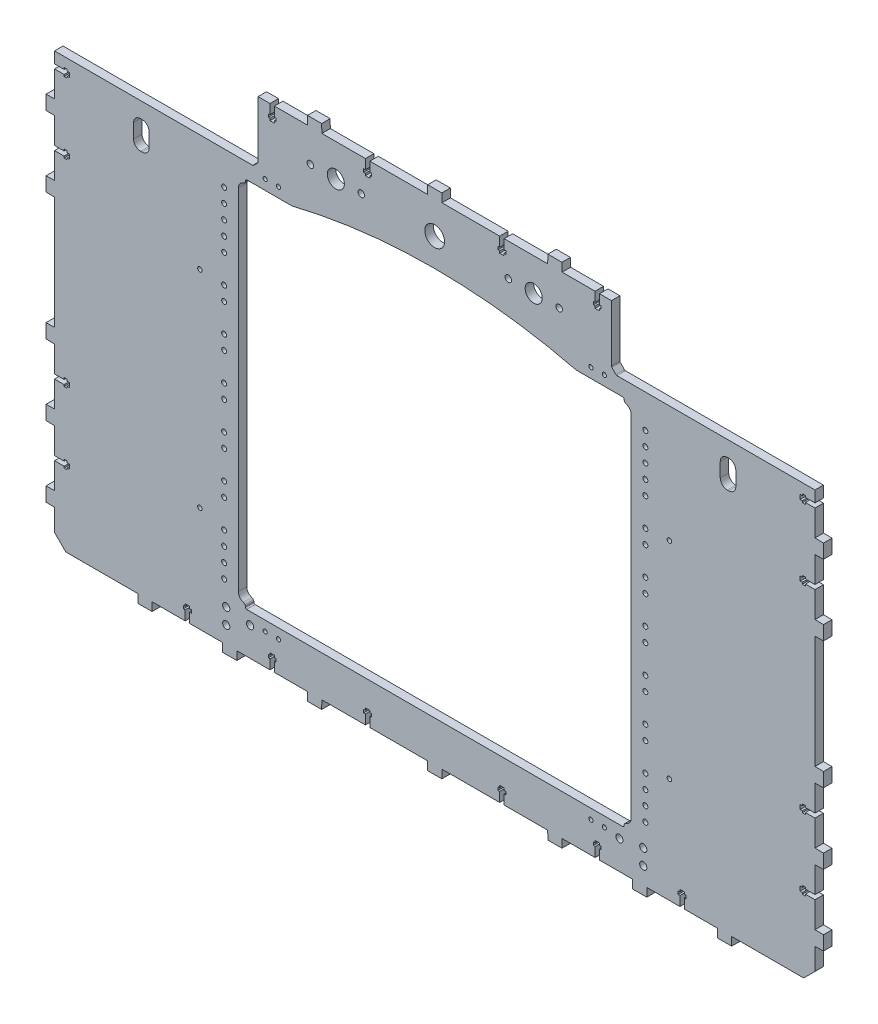
from build123d import *

# Parameters (mm, degrees)
SKETCH_1_R      = 1.6
SKETCH_1_R_2    = 1.75
SKETCH_1_R_3    = 2.55
SKETCH_1_R_4    = 1.5
SKETCH_1_R_5    = 2.3
SKETCH_1_R_6    = 6.05
SKETCH_1_R_7    = 7
EXTRUDE_1_DEPTH = 6


with BuildPart() as part:
    # Эскиз1 → Бобышка-Вытянуть1 (new body)
    with BuildSketch(Plane.XY):
        with BuildLine():
            Line((1433.58045076, 343.057239019), (1435.08045076, 343.057239019))
            Line((1435.08045076, 343.057239019), (1435.08045076, 339.95723902))
            Line((1435.08045076, 339.95723902), (1433.58045076, 339.95723902))
            Line((1433.58045076, 339.95723902), (1433.58045076, 338.75723902))
            Line((1433.58045076, 338.75723902), (1431.38045076, 338.75723902))
            Line((1431.38045076, 338.75723902), (1431.38045076, 339.95723902))
            Line((1431.38045076, 339.95723902), (1424.58045076, 339.95723902))
            Line((1424.58045076, 339.95723902), (1424.58045076, 321.60723902))
            Line((1424.58045076, 321.60723902), (1418.580450762, 321.50723902))
            Line((1418.580450762, 321.50723902), (1418.580450762, 311.50723902))
            Line((1418.580450762, 311.50723902), (1424.58045076, 311.407239019))
            Line((1424.58045076, 311.407239019), (1424.58045076, 293.05723902))
            Line((1424.58045076, 293.05723902), (1431.38045076, 293.05723902))
            Line((1431.38045076, 293.05723902), (1431.38045076, 294.25723902))
            Line((1431.38045076, 294.25723902), (1433.58045076, 294.25723902))
            Line((1433.58045076, 294.25723902), (1433.58045076, 293.05723902))
            Line((1433.58045076, 293.05723902), (1435.08045076, 293.05723902))
            Line((1435.08045076, 293.05723902), (1435.08045076, 289.95723902))
            Line((1435.08045076, 289.95723902), (1433.58045076, 289.95723902))
            Line((1433.58045076, 289.95723902), (1433.58045076, 288.75723902))
            Line((1433.58045076, 288.75723902), (1431.38045076, 288.75723902))
            Line((1431.38045076, 288.75723902), (1431.38045076, 289.95723902))
            Line((1431.38045076, 289.95723902), (1424.58045076, 289.95723902))
            Line((1424.58045076, 289.95723902), (1424.58045076, 271.60723902))
            Line((1424.58045076, 271.60723902), (1418.580450762, 271.50723902))
            Line((1418.580450762, 271.50723902), (1418.580450762, 261.50723902))
            Line((1418.580450762, 261.50723902), (1424.58045076, 261.407239019))
            Line((1424.58045076, 261.407239019), (1424.58045076, 181.60723902))
            Line((1424.58045076, 181.60723902), (1418.580450762, 181.50723902))
            Line((1418.580450762, 181.50723902), (1418.580450762, 171.50723902))
            Line((1418.580450762, 171.50723902), (1424.58045076, 171.407239019))
            Line((1424.58045076, 171.407239019), (1424.58045076, 153.05723902))
            Line((1424.58045076, 153.05723902), (1431.38045076, 153.05723902))
            Line((1431.38045076, 153.05723902), (1431.38045076, 154.257239019))
            Line((1431.38045076, 154.257239019), (1433.58045076, 154.257239019))
            Line((1433.58045076, 154.257239019), (1433.58045076, 153.057239019))
            Line((1433.58045076, 153.057239019), (1435.08045076, 153.057239019))
            Line((1435.08045076, 153.057239019), (1435.08045076, 149.957239019))
            Line((1435.08045076, 149.957239019), (1433.58045076, 149.957239019))
            Line((1433.58045076, 149.957239019), (1433.58045076, 148.757239019))
            Line((1433.58045076, 148.757239019), (1431.38045076, 148.757239019))
            Line((1431.38045076, 148.757239019), (1431.38045076, 149.957239019))
            Line((1431.38045076, 149.957239019), (1424.58045076, 149.957239019))
            Line((1424.58045076, 149.957239019), (1424.58045076, 131.607239019))
            Line((1424.58045076, 131.607239019), (1418.580450762, 131.507239019))
            Line((1418.580450762, 131.507239019), (1418.580450762, 121.507239019))
            Line((1418.580450762, 121.507239019), (1424.58045076, 121.407239018))
            Line((1424.58045076, 121.407239018), (1424.58045076, 103.057239019))
            Line((1424.58045076, 103.057239019), (1431.38045076, 103.057239019))
            Line((1431.38045076, 103.057239019), (1431.38045076, 104.257239019))
            Line((1431.38045076, 104.257239019), (1433.58045076, 104.257239019))
            Line((1433.58045076, 104.257239019), (1433.58045076, 103.057239019))
            Line((1433.58045076, 103.057239019), (1435.08045076, 103.057239019))
            Line((1435.08045076, 103.057239019), (1435.08045076, 99.957239019))
            Line((1435.08045076, 99.957239019), (1433.58045076, 99.957239019))
            Line((1433.58045076, 99.957239019), (1433.58045076, 98.757239019))
            Line((1433.58045076, 98.757239019), (1431.38045076, 98.757239019))
            Line((1431.38045076, 98.757239019), (1431.38045076, 99.957239019))
            Line((1431.38045076, 99.957239019), (1424.58045076, 99.957239019))
            Line((1424.58045076, 99.957239019), (1424.58045076, 81.607239019))
            Line((1424.58045076, 81.607239019), (1418.580450762, 81.507239019))
            Line((1418.580450762, 81.507239019), (1418.580450762, 71.507239019))
            Line((1418.580450762, 71.507239019), (1424.58045076, 71.407239018))
            Line((1424.58045076, 71.407239018), (1424.58045076, 56.007239019))
            Line((1424.58045076, 56.007239019), (1432.58045076, 48.007239019))
            Line((1432.58045076, 48.007239019), (1483.480450759, 48.007239019))
            Line((1483.480450759, 48.007239019), (1483.58045076, 42.00723902))
            Line((1483.58045076, 42.00723902), (1493.58045076, 42.00723902))
            Line((1493.58045076, 42.00723902), (1493.68045076, 48.007239019))
            Line((1493.68045076, 48.007239019), (1517.03045076, 48.007239019))
            Line((1517.03045076, 48.007239019), (1517.03045076, 54.807239019))
            Line((1517.03045076, 54.807239019), (1515.830450761, 54.807239019))
            Line((1515.830450761, 54.807239019), (1515.830450761, 57.007239019))
            Line((1515.830450761, 57.007239019), (1517.030450761, 57.007239019))
            Line((1517.030450761, 57.007239019), (1517.030450761, 58.507239019))
            Line((1517.030450761, 58.507239019), (1520.130450761, 58.507239019))
            Line((1520.130450761, 58.507239019), (1520.130450761, 57.007239019))
            Line((1520.130450761, 57.007239019), (1521.330450761, 57.007239019))
            Line((1521.330450761, 57.007239019), (1521.330450761, 54.807239019))
            Line((1521.330450761, 54.807239019), (1520.130450761, 54.807239019))
            Line((1520.130450761, 54.807239019), (1520.130450761, 48.007239019))
            Line((1520.130450761, 48.007239019), (1532.58045076, 48.007239019))
            Line((1532.58045076, 48.007239019), (1543.48045076, 48.007239019))
            Line((1543.48045076, 48.007239019), (1543.580450761, 42.00723902))
            Line((1543.580450761, 42.00723902), (1553.580450761, 42.00723902))
            Line((1553.580450761, 42.00723902), (1553.680450761, 48.007239018))
            Line((1553.680450761, 48.007239018), (1577.030450761, 48.007239018))
            Line((1577.030450761, 48.007239018), (1577.030450761, 54.807239018))
            Line((1577.030450761, 54.807239018), (1575.830450761, 54.807239018))
            Line((1575.830450761, 54.807239018), (1575.830450761, 57.007239018))
            Line((1575.830450761, 57.007239018), (1577.030450761, 57.007239018))
            Line((1577.030450761, 57.007239018), (1577.030450761, 58.507239018))
            Line((1577.030450761, 58.507239018), (1580.130450761, 58.507239018))
            Line((1580.130450761, 58.507239018), (1580.130450761, 57.007239018))
            Line((1580.130450761, 57.007239018), (1581.330450761, 57.007239018))
            Line((1581.330450761, 57.007239018), (1581.330450761, 54.807239018))
            Line((1581.330450761, 54.807239018), (1580.130450761, 54.807239018))
            Line((1580.130450761, 54.807239018), (1580.130450761, 48.007239018))
            Line((1580.130450761, 48.007239018), (1603.48045076, 48.007239018))
            Line((1603.48045076, 48.007239018), (1603.580450761, 42.007239019))
            Line((1603.580450761, 42.007239019), (1613.580450761, 42.007239019))
            Line((1613.580450761, 42.007239019), (1613.680450761, 48.007239017))
            Line((1613.680450761, 48.007239017), (1644.530450761, 48.007239017))
            Line((1644.530450761, 48.007239017), (1644.530450761, 54.807239017))
            Line((1644.530450761, 54.807239017), (1643.330450762, 54.807239017))
            Line((1643.330450762, 54.807239017), (1643.330450762, 57.007239017))
            Line((1643.330450762, 57.007239017), (1644.530450762, 57.007239017))
            Line((1644.530450762, 57.007239017), (1644.530450762, 58.507239017))
            Line((1644.530450762, 58.507239017), (1647.630450762, 58.507239017))
            Line((1647.630450762, 58.507239017), (1647.630450762, 57.007239017))
            Line((1647.630450762, 57.007239017), (1648.830450762, 57.007239017))
            Line((1648.830450762, 57.007239017), (1648.830450762, 54.807239017))
            Line((1648.830450762, 54.807239017), (1647.630450762, 54.807239017))
            Line((1647.630450762, 54.807239017), (1647.630450762, 48.007239017))
            Line((1647.630450762, 48.007239017), (1688.480450762, 48.007239017))
            Line((1688.480450762, 48.007239017), (1688.580450762, 42.007239019))
            Line((1688.580450762, 42.007239019), (1698.580450762, 42.007239019))
            Line((1698.580450762, 42.007239019), (1698.680450762, 48.007239017))
            Line((1698.680450762, 48.007239017), (1739.530450762, 48.007239017))
            Line((1739.530450762, 48.007239017), (1739.530450762, 54.807239017))
            Line((1739.530450762, 54.807239017), (1738.330450762, 54.807239017))
            Line((1738.330450762, 54.807239017), (1738.330450762, 57.007239017))
            Line((1738.330450762, 57.007239017), (1739.530450762, 57.007239017))
            Line((1739.530450762, 57.007239017), (1739.530450762, 58.507239017))
            Line((1739.530450762, 58.507239017), (1742.630450762, 58.507239017))
            Line((1742.630450762, 58.507239017), (1742.630450762, 57.007239017))
            Line((1742.630450762, 57.007239017), (1743.830450762, 57.007239017))
            Line((1743.830450762, 57.007239017), (1743.830450762, 54.807239017))
            Line((1743.830450762, 54.807239017), (1742.630450762, 54.807239017))
            Line((1742.630450762, 54.807239017), (1742.630450762, 48.007239017))
            Line((1742.630450762, 48.007239017), (1773.480450762, 48.007239017))
            Line((1773.480450762, 48.007239017), (1773.580450762, 42.007239018))
            Line((1773.580450762, 42.007239018), (1783.580450762, 42.007239018))
            Line((1783.580450762, 42.007239018), (1783.680450762, 48.007239017))
            Line((1783.680450762, 48.007239017), (1807.030450762, 48.007239017))
            Line((1807.030450762, 48.007239017), (1807.030450762, 54.807239017))
            Line((1807.030450762, 54.807239017), (1805.830450762, 54.807239017))
            Line((1805.830450762, 54.807239017), (1805.830450762, 57.007239017))
            Line((1805.830450762, 57.007239017), (1807.030450762, 57.007239017))
            Line((1807.030450762, 57.007239017), (1807.030450762, 58.507239017))
            Line((1807.030450762, 58.507239017), (1810.130450762, 58.507239017))
            Line((1810.130450762, 58.507239017), (1810.130450762, 57.007239017))
            Line((1810.130450762, 57.007239017), (1811.330450762, 57.007239017))
            Line((1811.330450762, 57.007239017), (1811.330450762, 54.807239017))
            Line((1811.330450762, 54.807239017), (1810.130450762, 54.807239017))
            Line((1810.130450762, 54.807239017), (1810.130450762, 48.007239017))
            Line((1810.130450762, 48.007239017), (1833.480450762, 48.007239017))
            Line((1833.480450762, 48.007239017), (1833.580450762, 42.007239018))
            Line((1833.580450762, 42.007239018), (1843.580450762, 42.007239018))
            Line((1843.580450762, 42.007239018), (1843.680450762, 48.007239017))
            Line((1843.680450762, 48.007239017), (1854.580450762, 48.007239017))
            Line((1854.580450762, 48.007239017), (1867.030450762, 48.007239017))
            Line((1867.030450762, 48.007239017), (1867.030450762, 54.807239017))
            Line((1867.030450762, 54.807239017), (1865.830450762, 54.807239017))
            Line((1865.830450762, 54.807239017), (1865.830450762, 57.007239017))
            Line((1865.830450762, 57.007239017), (1867.030450762, 57.007239017))
            Line((1867.030450762, 57.007239017), (1867.030450762, 58.507239017))
            Line((1867.030450762, 58.507239017), (1870.130450762, 58.507239017))
            Line((1870.130450762, 58.507239017), (1870.130450762, 57.007239017))
            Line((1870.130450762, 57.007239017), (1871.330450762, 57.007239017))
            Line((1871.330450762, 57.007239017), (1871.330450762, 54.807239017))
            Line((1871.330450762, 54.807239017), (1870.130450762, 54.807239017))
            Line((1870.130450762, 54.807239017), (1870.130450762, 48.007239017))
            Line((1870.130450762, 48.007239017), (1893.480450762, 48.007239017))
            Line((1893.480450762, 48.007239017), (1893.580450762, 42.007239018))
            Line((1893.580450762, 42.007239018), (1903.580450762, 42.007239018))
            Line((1903.580450762, 42.007239018), (1903.680450762, 48.007239017))
            Line((1903.680450762, 48.007239017), (1954.580450762, 48.007239017))
            Line((1954.580450762, 48.007239017), (1962.58045076, 56.007239017))
            Line((1962.58045076, 56.007239017), (1962.58045076, 71.407239016))
            Line((1962.58045076, 71.407239016), (1968.580450759, 71.507239016))
            Line((1968.580450759, 71.507239016), (1968.580450759, 81.507239016))
            Line((1968.580450759, 81.507239016), (1962.58045076, 81.607239016))
            Line((1962.58045076, 81.607239016), (1962.58045076, 99.957239016))
            Line((1962.58045076, 99.957239016), (1955.78045076, 99.957239016))
            Line((1955.78045076, 99.957239016), (1955.78045076, 98.757239016))
            Line((1955.78045076, 98.757239016), (1953.58045076, 98.757239016))
            Line((1953.58045076, 98.757239016), (1953.58045076, 99.957239016))
            Line((1953.58045076, 99.957239016), (1952.08045076, 99.957239016))
            Line((1952.08045076, 99.957239016), (1952.08045076, 103.057239016))
            Line((1952.08045076, 103.057239016), (1953.58045076, 103.057239016))
            Line((1953.58045076, 103.057239016), (1953.58045076, 104.257239016))
            Line((1953.58045076, 104.257239016), (1955.78045076, 104.257239016))
            Line((1955.78045076, 104.257239016), (1955.78045076, 103.057239016))
            Line((1955.78045076, 103.057239016), (1962.58045076, 103.057239016))
            Line((1962.58045076, 103.057239016), (1962.58045076, 121.407239016))
            Line((1962.58045076, 121.407239016), (1968.580450759, 121.507239016))
            Line((1968.580450759, 121.507239016), (1968.580450759, 131.507239016))
            Line((1968.580450759, 131.507239016), (1962.58045076, 131.607239016))
            Line((1962.58045076, 131.607239016), (1962.58045076, 149.957239016))
            Line((1962.58045076, 149.957239016), (1955.78045076, 149.957239016))
            Line((1955.78045076, 149.957239016), (1955.78045076, 148.757239016))
            Line((1955.78045076, 148.757239016), (1953.58045076, 148.757239016))
            Line((1953.58045076, 148.757239016), (1953.58045076, 149.957239016))
            Line((1953.58045076, 149.957239016), (1952.08045076, 149.957239016))
            Line((1952.08045076, 149.957239016), (1952.08045076, 153.057239016))
            Line((1952.08045076, 153.057239016), (1953.58045076, 153.057239016))
            Line((1953.58045076, 153.057239016), (1953.58045076, 154.257239016))
            Line((1953.58045076, 154.257239016), (1955.78045076, 154.257239016))
            Line((1955.78045076, 154.257239016), (1955.78045076, 153.057239016))
            Line((1955.78045076, 153.057239016), (1962.58045076, 153.057239016))
            Line((1962.58045076, 153.057239016), (1962.58045076, 171.407239016))
            Line((1962.58045076, 171.407239016), (1968.580450759, 171.507239016))
            Line((1968.580450759, 171.507239016), (1968.580450759, 181.507239016))
            Line((1968.580450759, 181.507239016), (1962.58045076, 181.607239016))
            Line((1962.58045076, 181.607239016), (1962.58045076, 261.407239016))
            Line((1962.58045076, 261.407239016), (1968.580450759, 261.507239017))
            Line((1968.580450759, 261.507239017), (1968.580450759, 271.507239017))
            Line((1968.580450759, 271.507239017), (1962.58045076, 271.607239017))
            Line((1962.58045076, 271.607239017), (1962.58045076, 289.957239017))
            Line((1962.58045076, 289.957239017), (1955.78045076, 289.957239017))
            Line((1955.78045076, 289.957239017), (1955.78045076, 288.757239017))
            Line((1955.78045076, 288.757239017), (1953.58045076, 288.757239017))
            Line((1953.58045076, 288.757239017), (1953.58045076, 289.957239017))
            Line((1953.58045076, 289.957239017), (1952.08045076, 289.957239017))
            Line((1952.08045076, 289.957239017), (1952.08045076, 293.057239017))
            Line((1952.08045076, 293.057239017), (1953.58045076, 293.057239017))
            Line((1953.58045076, 293.057239017), (1953.58045076, 294.257239017))
            Line((1953.58045076, 294.257239017), (1955.78045076, 294.257239017))
            Line((1955.78045076, 294.257239017), (1955.78045076, 293.057239017))
            Line((1955.78045076, 293.057239017), (1962.58045076, 293.057239017))
            Line((1962.58045076, 293.057239017), (1962.58045076, 311.407239016))
            Line((1962.58045076, 311.407239016), (1968.580450759, 311.507239017))
            Line((1968.580450759, 311.507239017), (1968.580450759, 321.507239017))
            Line((1968.580450759, 321.507239017), (1962.58045076, 321.607239017))
            Line((1962.58045076, 321.607239017), (1962.58045076, 339.957239017))
            Line((1962.58045076, 339.957239017), (1955.78045076, 339.957239017))
            Line((1955.78045076, 339.957239017), (1955.78045076, 338.757239018))
            Line((1955.78045076, 338.757239018), (1953.58045076, 338.757239018))
            Line((1953.58045076, 338.757239018), (1953.58045076, 339.957239018))
            Line((1953.58045076, 339.957239018), (1952.08045076, 339.957239018))
            Line((1952.08045076, 339.957239018), (1952.08045076, 343.057239018))
            Line((1952.08045076, 343.057239018), (1953.58045076, 343.057239018))
            Line((1953.58045076, 343.057239018), (1953.58045076, 344.257239018))
            Line((1953.58045076, 344.257239018), (1955.78045076, 344.257239018))
            Line((1955.78045076, 344.257239018), (1955.78045076, 343.057239018))
            Line((1955.78045076, 343.057239018), (1962.58045076, 343.057239018))
            Line((1962.58045076, 343.057239018), (1962.58045076, 351.007239019))
            Line((1962.58045076, 351.007239019), (1862.580450761, 351.007239019))
            Line((1862.580450761, 351.007239019), (1822.494664324, 351.007239019))
            ThreePointArc((1822.494664324, 351.007239019), (1822.111980891, 351.083359486), (1821.787557542, 351.300132238))
            Line((1821.787557542, 351.300132238), (1818.87334398, 354.2143458))
            ThreePointArc((1818.87334398, 354.2143458), (1818.656571229, 354.538769149), (1818.580450761, 354.921452581))
            Line((1818.580450761, 354.921452581), (1818.580450761, 395.007239019))
            Line((1818.580450761, 395.007239019), (1810.130450761, 395.007239019))
            Line((1810.130450761, 395.007239019), (1810.130450761, 388.207239019))
            Line((1810.130450761, 388.207239019), (1811.330450761, 388.207239019))
            Line((1811.330450761, 388.207239019), (1811.330450761, 386.007239019))
            Line((1811.330450761, 386.007239019), (1810.130450761, 386.007239019))
            Line((1810.130450761, 386.007239019), (1810.130450761, 384.507239019))
            Line((1810.130450761, 384.507239019), (1807.030450761, 384.507239019))
            Line((1807.030450761, 384.507239019), (1807.030450761, 386.007239019))
            Line((1807.030450761, 386.007239019), (1805.830450761, 386.007239019))
            Line((1805.830450761, 386.007239019), (1805.830450761, 388.207239019))
            Line((1805.830450761, 388.207239019), (1807.030450761, 388.207239019))
            Line((1807.030450761, 388.207239019), (1807.030450761, 395.007239019))
            Line((1807.030450761, 395.007239019), (1783.680450762, 395.007239019))
            Line((1783.680450762, 395.007239019), (1783.580450761, 401.007239017))
            Line((1783.580450761, 401.007239017), (1773.580450761, 401.007239017))
            Line((1773.580450761, 401.007239017), (1773.480450761, 395.007239019))
            Line((1773.480450761, 395.007239019), (1742.630450761, 395.007239019))
            Line((1742.630450761, 395.007239019), (1742.630450761, 388.207239019))
            Line((1742.630450761, 388.207239019), (1743.83045076, 388.207239019))
            Line((1743.83045076, 388.207239019), (1743.83045076, 386.007239019))
            Line((1743.83045076, 386.007239019), (1742.63045076, 386.007239019))
            Line((1742.63045076, 386.007239019), (1742.63045076, 384.507239019))
            Line((1742.63045076, 384.507239019), (1739.53045076, 384.507239019))
            Line((1739.53045076, 384.507239019), (1739.53045076, 386.007239019))
            Line((1739.53045076, 386.007239019), (1738.33045076, 386.007239019))
            Line((1738.33045076, 386.007239019), (1738.33045076, 388.207239019))
            Line((1738.33045076, 388.207239019), (1739.53045076, 388.207239019))
            Line((1739.53045076, 388.207239019), (1739.53045076, 395.007239019))
            Line((1739.53045076, 395.007239019), (1698.680450761, 395.007239019))
            Line((1698.680450761, 395.007239019), (1698.58045076, 401.007239017))
            Line((1698.58045076, 401.007239017), (1688.58045076, 401.007239017))
            Line((1688.58045076, 401.007239017), (1688.48045076, 395.007239019))
            Line((1688.48045076, 395.007239019), (1647.63045076, 395.007239019))
            Line((1647.63045076, 395.007239019), (1647.63045076, 388.207239019))
            Line((1647.63045076, 388.207239019), (1648.83045076, 388.207239019))
            Line((1648.83045076, 388.207239019), (1648.83045076, 386.007239019))
            Line((1648.83045076, 386.007239019), (1647.63045076, 386.007239019))
            Line((1647.63045076, 386.007239019), (1647.63045076, 384.507239019))
            Line((1647.63045076, 384.507239019), (1644.53045076, 384.507239019))
            Line((1644.53045076, 384.507239019), (1644.53045076, 386.007239019))
            Line((1644.53045076, 386.007239019), (1643.33045076, 386.007239019))
            Line((1643.33045076, 386.007239019), (1643.33045076, 388.207239019))
            Line((1643.33045076, 388.207239019), (1644.53045076, 388.207239019))
            Line((1644.53045076, 388.207239019), (1644.53045076, 395.007239019))
            Line((1644.53045076, 395.007239019), (1613.680450761, 395.007239019))
            Line((1613.680450761, 395.007239019), (1613.58045076, 401.007239017))
            Line((1613.58045076, 401.007239017), (1603.58045076, 401.007239017))
            Line((1603.58045076, 401.007239017), (1603.48045076, 395.007239019))
            Line((1603.48045076, 395.007239019), (1580.13045076, 395.007239019))
            Line((1580.13045076, 395.007239019), (1580.13045076, 388.207239019))
            Line((1580.13045076, 388.207239019), (1581.33045076, 388.207239019))
            Line((1581.33045076, 388.207239019), (1581.33045076, 386.007239019))
            Line((1581.33045076, 386.007239019), (1580.13045076, 386.007239019))
            Line((1580.13045076, 386.007239019), (1580.13045076, 384.507239019))
            Line((1580.13045076, 384.507239019), (1577.03045076, 384.507239019))
            Line((1577.03045076, 384.507239019), (1577.03045076, 386.007239019))
            Line((1577.03045076, 386.007239019), (1575.83045076, 386.007239019))
            Line((1575.83045076, 386.007239019), (1575.83045076, 388.207239019))
            Line((1575.83045076, 388.207239019), (1577.03045076, 388.207239019))
            Line((1577.03045076, 388.207239019), (1577.03045076, 395.007239019))
            Line((1577.03045076, 395.007239019), (1568.58045076, 395.007239019))
            Line((1568.58045076, 395.007239019), (1568.58045076, 354.921452581))
            ThreePointArc((1568.58045076, 354.921452581), (1568.504330292, 354.538769149), (1568.287557541, 354.2143458))
            Line((1568.287557541, 354.2143458), (1565.373343979, 351.300132238))
            ThreePointArc((1565.373343979, 351.300132238), (1565.04892063, 351.083359486), (1564.666237198, 351.007239019))
            Line((1564.666237198, 351.007239019), (1524.58045076, 351.007239019))
            Line((1524.58045076, 351.007239019), (1424.58045076, 351.007239019))
            Line((1424.58045076, 351.007239019), (1424.58045076, 343.057239019))
            Line((1424.58045076, 343.057239019), (1431.38045076, 343.057239019))
            Line((1431.38045076, 343.057239019), (1431.38045076, 344.257239019))
            Line((1431.38045076, 344.257239019), (1433.58045076, 344.257239019))
            Line((1433.58045076, 344.257239019), (1433.58045076, 343.057239019))
        make_face()
        with Locations((1859.58045076, 268.557239017)):
            Circle(SKETCH_1_R, mode=Mode.SUBTRACT)
        with Locations((1859.58045076, 122.557239017)):
            Circle(SKETCH_1_R, mode=Mode.SUBTRACT)
        with Locations((1527.442189288, 268.557239017)):
            Circle(SKETCH_1_R, mode=Mode.SUBTRACT)
        with Locations((1527.442189288, 122.557239017)):
            Circle(SKETCH_1_R, mode=Mode.SUBTRACT)
        with Locations((1544.58045076, 177.507239237)):
            Circle(SKETCH_1_R_2, mode=Mode.SUBTRACT)
        with Locations((1544.58045076, 147.507239237)):
            Circle(SKETCH_1_R_2, mode=Mode.SUBTRACT)
        with Locations((1544.58045076, 137.507239237)):
            Circle(SKETCH_1_R_2, mode=Mode.SUBTRACT)
        with Locations((1544.58045076, 117.507239237)):
            Circle(SKETCH_1_R_2, mode=Mode.SUBTRACT)
        with Locations((1544.58045076, 107.507239237)):
            Circle(SKETCH_1_R_2, mode=Mode.SUBTRACT)
        with Locations((1544.58045076, 97.507239237)):
            Circle(SKETCH_1_R_2, mode=Mode.SUBTRACT)
        with Locations((1544.58045076, 87.507239237)):
            Circle(SKETCH_1_R_2, mode=Mode.SUBTRACT)
        with Locations((1546.08045076, 71.007239019)):
            Circle(SKETCH_1_R_3, mode=Mode.SUBTRACT)
        with Locations((1546.08045076, 60.007239019)):
            Circle(SKETCH_1_R_3, mode=Mode.SUBTRACT)
        with Locations((1544.58045076, 197.507239237)):
            Circle(SKETCH_1_R_2, mode=Mode.SUBTRACT)
        with Locations((1544.58045076, 207.507239237)):
            Circle(SKETCH_1_R_2, mode=Mode.SUBTRACT)
        with Locations((1544.58045076, 227.507239237)):
            Circle(SKETCH_1_R_2, mode=Mode.SUBTRACT)
        with Locations((1544.58045076, 237.507239237)):
            Circle(SKETCH_1_R_2, mode=Mode.SUBTRACT)
        with Locations((1544.58045076, 257.507239237)):
            Circle(SKETCH_1_R_2, mode=Mode.SUBTRACT)
        with Locations((1544.58045076, 267.507239237)):
            Circle(SKETCH_1_R_2, mode=Mode.SUBTRACT)
        with Locations((1544.58045076, 287.507239237)):
            Circle(SKETCH_1_R_2, mode=Mode.SUBTRACT)
        with Locations((1544.58045076, 297.507239237)):
            Circle(SKETCH_1_R_2, mode=Mode.SUBTRACT)
        with Locations((1544.58045076, 307.507239237)):
            Circle(SKETCH_1_R_2, mode=Mode.SUBTRACT)
        with Locations((1544.58045076, 317.507239237)):
            Circle(SKETCH_1_R_2, mode=Mode.SUBTRACT)
        with Locations((1544.58045076, 327.507239237)):
            Circle(SKETCH_1_R_2, mode=Mode.SUBTRACT)
        with Locations((1573.58045076, 347.007239019)):
            Circle(SKETCH_1_R_4, mode=Mode.SUBTRACT)
        with Locations((1583.08045076, 347.007239019)):
            Circle(SKETCH_1_R_4, mode=Mode.SUBTRACT)
        with Locations((1605.58045076, 372.007239019)):
            Circle(SKETCH_1_R_5, mode=Mode.SUBTRACT)
        with Locations((1623.58045076, 372.007239019)):
            Circle(SKETCH_1_R_6, mode=Mode.SUBTRACT)
        with Locations((1641.58045076, 372.007239019)):
            Circle(SKETCH_1_R_5, mode=Mode.SUBTRACT)
        with Locations((1693.511320024, 372.007239019)):
            Circle(SKETCH_1_R_7, mode=Mode.SUBTRACT)
        with Locations((1745.58045076, 372.007239019)):
            Circle(SKETCH_1_R_5, mode=Mode.SUBTRACT)
        with Locations((1763.58045076, 372.007239019)):
            Circle(SKETCH_1_R_6, mode=Mode.SUBTRACT)
        with Locations((1781.58045076, 372.007239019)):
            Circle(SKETCH_1_R_5, mode=Mode.SUBTRACT)
        with Locations((1804.08045076, 347.007239019)):
            Circle(SKETCH_1_R_4, mode=Mode.SUBTRACT)
        with Locations((1813.58045076, 347.007239019)):
            Circle(SKETCH_1_R_4, mode=Mode.SUBTRACT)
        with Locations((1842.58045076, 327.507239019)):
            Circle(SKETCH_1_R_2, mode=Mode.SUBTRACT)
        with Locations((1842.58045076, 317.507239019)):
            Circle(SKETCH_1_R_2, mode=Mode.SUBTRACT)
        with Locations((1842.58045076, 307.507239019)):
            Circle(SKETCH_1_R_2, mode=Mode.SUBTRACT)
        with Locations((1842.58045076, 297.507239019)):
            Circle(SKETCH_1_R_2, mode=Mode.SUBTRACT)
        with Locations((1842.58045076, 287.507239019)):
            Circle(SKETCH_1_R_2, mode=Mode.SUBTRACT)
        with Locations((1842.58045076, 267.507239019)):
            Circle(SKETCH_1_R_2, mode=Mode.SUBTRACT)
        with Locations((1842.58045076, 257.507239019)):
            Circle(SKETCH_1_R_2, mode=Mode.SUBTRACT)
        with Locations((1842.58045076, 237.507239019)):
            Circle(SKETCH_1_R_2, mode=Mode.SUBTRACT)
        with Locations((1842.58045076, 227.507239019)):
            Circle(SKETCH_1_R_2, mode=Mode.SUBTRACT)
        with Locations((1842.58045076, 207.507239019)):
            Circle(SKETCH_1_R_2, mode=Mode.SUBTRACT)
        with Locations((1842.58045076, 197.507239019)):
            Circle(SKETCH_1_R_2, mode=Mode.SUBTRACT)
        with Locations((1842.58045076, 177.507239019)):
            Circle(SKETCH_1_R_2, mode=Mode.SUBTRACT)
        with Locations((1842.58045076, 167.507239019)):
            Circle(SKETCH_1_R_2, mode=Mode.SUBTRACT)
        with Locations((1842.58045076, 147.507239019)):
            Circle(SKETCH_1_R_2, mode=Mode.SUBTRACT)
        with Locations((1842.58045076, 137.507239019)):
            Circle(SKETCH_1_R_2, mode=Mode.SUBTRACT)
        with Locations((1842.58045076, 117.507239019)):
            Circle(SKETCH_1_R_2, mode=Mode.SUBTRACT)
        with Locations((1842.58045076, 107.507239019)):
            Circle(SKETCH_1_R_2, mode=Mode.SUBTRACT)
        with Locations((1842.58045076, 97.507239019)):
            Circle(SKETCH_1_R_2, mode=Mode.SUBTRACT)
        with Locations((1842.58045076, 87.507239019)):
            Circle(SKETCH_1_R_2, mode=Mode.SUBTRACT)
        with Locations((1841.08045076, 71.007239019)):
            Circle(SKETCH_1_R_3, mode=Mode.SUBTRACT)
        with Locations((1841.08045076, 60.007239019)):
            Circle(SKETCH_1_R_3, mode=Mode.SUBTRACT)
        with Locations((1824.227659727, 68.296772665)):
            Circle(SKETCH_1_R_3, mode=Mode.SUBTRACT)
        with Locations((1813.58045076, 69.78654025)):
            Circle(SKETCH_1_R_4, mode=Mode.SUBTRACT)
        with Locations((1804.08045076, 69.78654025)):
            Circle(SKETCH_1_R_4, mode=Mode.SUBTRACT)
        with Locations((1583.08045076, 69.78654025)):
            Circle(SKETCH_1_R_4, mode=Mode.SUBTRACT)
        with Locations((1573.58045076, 69.78654025)):
            Circle(SKETCH_1_R_4, mode=Mode.SUBTRACT)
        with Locations((1562.93045076, 68.296772665)):
            Circle(SKETCH_1_R_3, mode=Mode.SUBTRACT)
        with Locations((1544.58045076, 167.507239237)):
            Circle(SKETCH_1_R_2, mode=Mode.SUBTRACT)
        with BuildLine():
            Line((1560.58045076, 76.78654025), (1826.579713792, 76.78654025))
            ThreePointArc((1826.579713792, 76.78654025), (1827.286820573, 77.079433469), (1827.579713792, 77.78654025))
            Line((1827.579713792, 77.78654025), (1827.579713792, 78.078336318))
            ThreePointArc((1827.579713792, 78.078336318), (1827.976146341, 79.273564927), (1829.008285221, 79.994966013))
            ThreePointArc((1829.008285221, 79.994966013), (1831.588627971, 81.798462757), (1832.579713792, 84.786525358))
            Line((1832.579713792, 84.786525358), (1832.580467982, 332.007224127))
            ThreePointArc((1832.580467982, 332.007224127), (1831.589391061, 334.995304572), (1829.009039411, 336.798813257))
            ThreePointArc((1829.009039411, 336.798813257), (1827.976900531, 337.520214342), (1827.580467982, 338.715442951))
            Line((1827.580467982, 338.715442951), (1827.580467982, 339.007239019))
            ThreePointArc((1827.580467982, 339.007239019), (1827.287574764, 339.7143458), (1826.580467982, 340.007239019))
            Line((1826.580467982, 340.007239019), (1793.680450761, 340.007239019))
            ThreePointArc((1793.680450761, 340.007239019), (1693.122117427, 352.15701974), (1592.563784093, 340.007239019))
            Line((1592.563784093, 340.007239019), (1560.58045076, 340.007239019))
            ThreePointArc((1560.58045076, 340.007239019), (1559.873343979, 339.7143458), (1559.58045076, 339.007239019))
            Line((1559.58045076, 339.007239019), (1559.58045076, 338.715442951))
            ThreePointArc((1559.58045076, 338.715442951), (1559.184018212, 337.520214342), (1558.151879332, 336.798813256))
            ThreePointArc((1558.151879332, 336.798813256), (1555.571532132, 334.995310542), (1554.58045076, 332.007239019))
            Line((1554.58045076, 332.007239019), (1554.58045076, 84.78654025))
            ThreePointArc((1554.58045076, 84.78654025), (1555.571532132, 81.798468727), (1558.151879332, 79.994966012))
            ThreePointArc((1558.151879332, 79.994966012), (1559.184018212, 79.273564927), (1559.58045076, 78.078336317))
            Line((1559.58045076, 78.078336317), (1559.58045076, 77.78654025))
            ThreePointArc((1559.58045076, 77.78654025), (1559.873343979, 77.079433469), (1560.58045076, 76.78654025))
        make_face(mode=Mode.SUBTRACT)
        with BuildLine():
            Line((1900.540471295, 339.95723902), (1901.540471295, 339.95723902))
            ThreePointArc((1901.540471295, 339.95723902), (1905.0760052, 338.492772926), (1906.540471295, 334.95723902))
            Line((1906.540471295, 334.95723902), (1906.540471295, 324.95723902))
            ThreePointArc((1906.540471295, 324.95723902), (1905.0760052, 321.421705114), (1901.540471295, 319.95723902))
            Line((1901.540471295, 319.95723902), (1900.540471295, 319.95723902))
            ThreePointArc((1900.540471295, 319.95723902), (1897.004937389, 321.421705114), (1895.540471295, 324.95723902))
            Line((1895.540471295, 324.95723902), (1895.540471295, 334.95723902))
            ThreePointArc((1895.540471295, 334.95723902), (1897.004937389, 338.492772926), (1900.540471295, 339.95723902))
        make_face(mode=Mode.SUBTRACT)
        with BuildLine():
            Line((1486.482168754, 319.95723902), (1485.482168754, 319.95723902))
            ThreePointArc((1485.482168754, 319.95723902), (1481.946634848, 321.421705114), (1480.482168754, 324.95723902))
            Line((1480.482168754, 324.95723902), (1480.482168754, 334.95723902))
            ThreePointArc((1480.482168754, 334.95723902), (1481.946634848, 338.492772926), (1485.482168754, 339.95723902))
            Line((1485.482168754, 339.95723902), (1486.482168754, 339.95723902))
            ThreePointArc((1486.482168754, 339.95723902), (1490.01770266, 338.492772926), (1491.482168754, 334.95723902))
            Line((1491.482168754, 334.95723902), (1491.482168754, 324.95723902))
            ThreePointArc((1491.482168754, 324.95723902), (1490.01770266, 321.421705114), (1486.482168754, 319.95723902))
        make_face(mode=Mode.SUBTRACT)
    extrude(amount=EXTRUDE_1_DEPTH)


solid = part.part
